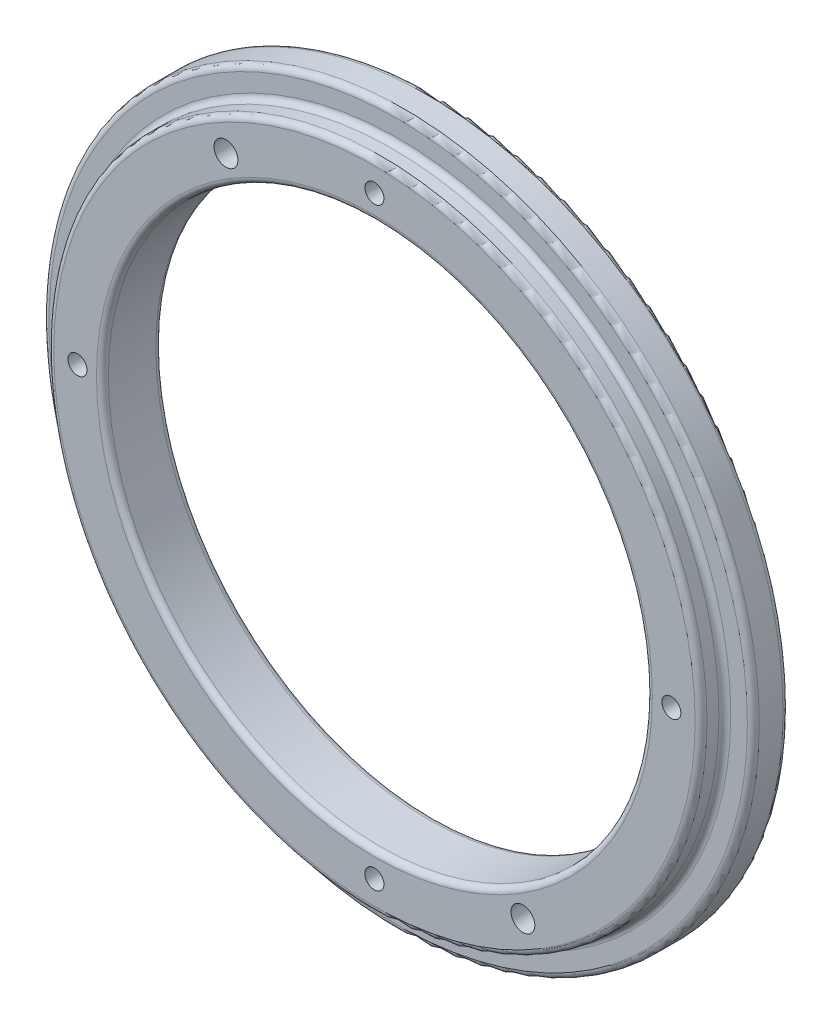
from build123d import *

# Parameters (mm, degrees)
BULKHEAD_LID_PROFILE_R     = 75.946
BULKHEAD_LID_PROFILE_R_2   = 58.166
BULKHEAD_LID_BODY_DEPTH    = 7.62
LIP_PROFILE_R              = 69.85
LIP_PROFILE_R_2            = 58.166
BULKHEAD_LID_LIP_DEPTH     = 5.08
SCREW_HOLE_PROFILE_R       = 2.032
BULKHEAD_SCREW_HOLES_DEPTH = 109.152114321
FILLET1_R                  = 1.27
THREADED_ROD_PROFILE_R     = 2.5527
THREADED_ROD_HOLES_DEPTH   = 109.152114391


with BuildPart() as part:
    # Bulkhead Lid Profile → Bulkhead Lid Body (new body)
    with BuildSketch(Plane.XY):
        Circle(BULKHEAD_LID_PROFILE_R)
        Circle(BULKHEAD_LID_PROFILE_R_2, mode=Mode.SUBTRACT)
    extrude(amount=BULKHEAD_LID_BODY_DEPTH)

    # Lip Profile → Bulkhead Lid Lip (add)
    with BuildSketch(Plane.XY.offset(7.62)):
        Circle(LIP_PROFILE_R)
        Circle(LIP_PROFILE_R_2, mode=Mode.SUBTRACT)
    extrude(amount=BULKHEAD_LID_LIP_DEPTH)

    # Screw Hole Profile → Bulkhead Screw Holes (cut, through all)
    with BuildSketch(Plane(origin=(0, 0, 0), x_dir=(-1, 0, 0), z_dir=(0, 0, -1))):
        with Locations((0, 63.5)):
            Circle(SCREW_HOLE_PROFILE_R)
        with Locations((63.5, 0)):
            Circle(SCREW_HOLE_PROFILE_R)
        with Locations((0, -63.5)):
            Circle(SCREW_HOLE_PROFILE_R)
        with Locations((-63.5, 0)):
            Circle(SCREW_HOLE_PROFILE_R)
    extrude(amount=-BULKHEAD_SCREW_HOLES_DEPTH, mode=Mode.SUBTRACT)

    # Fillet1
    fillet1_edges = [part.edges().sort_by_distance(p)[0] for p in [
        (-58.166, 0, 12.7),
        (-58.166, 0, 0),
        (-69.85, 0, 7.62),
        (-69.85, 0, 12.7),
        (-75.946, 0, 7.62),
        (-75.946, 0, 0),
    ]]
    fillet(fillet1_edges, radius=FILLET1_R)

    # Threaded Rod Profile → Threaded Rod Holes (cut, through all)
    with BuildSketch(Plane(origin=(0, 0, 0), x_dir=(-1, 0, 0), z_dir=(0, 0, -1))):
        with Locations((-31.75, -54.99261314)):
            Circle(THREADED_ROD_PROFILE_R)
        with Locations((31.75, 54.99261314)):
            Circle(THREADED_ROD_PROFILE_R)
    extrude(amount=-THREADED_ROD_HOLES_DEPTH, mode=Mode.SUBTRACT)


solid = part.part
